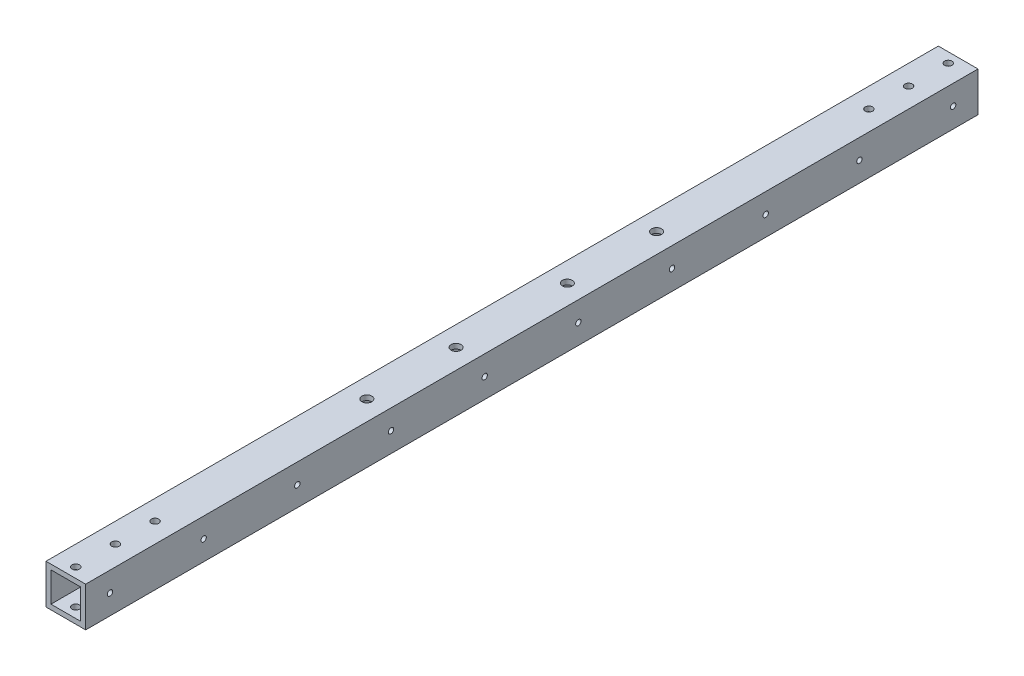
from build123d import *

# Parameters (mm, degrees)
SKETCH1_W                      = 25.4
SKETCH1_H                      = 25.4
SKETCH1_W_2                    = 19.05
SKETCH1_H_2                    = 19.05
EXTRUDE_THIN1_DEPTH            = 571.5
F_3_16_0_1875_DIAMETER_HOLE1_D = 4.7625
F_1_4_0_25_DIAMETER_HOLE1_D    = 6.35
F_8_32_TAPPED_HOLE1_D          = 3.4544
F_8_32_TAPPED_HOLE1_DEPTH      = 12.2936
F_8_32_TAPPED_HOLE1_TIP        = 1.037806461


with BuildPart() as part:
    # Sketch1 → Extrude-Thin1 (new body)
    with BuildSketch(Plane.XY):
        Rectangle(SKETCH1_W, SKETCH1_H)
        Rectangle(SKETCH1_W_2, SKETCH1_H_2, mode=Mode.SUBTRACT)
    extrude(amount=EXTRUDE_THIN1_DEPTH)

    # 3/16 (0.1875) Diameter Hole1 (through all)
    with Locations(Plane(origin=(0, 12.7, 565.15), x_dir=(0, 0, 1), z_dir=(0, 1, 0))):
        with Locations((0, 0), (-558.8, 0), (-533.4, 0), (-508, 0), (-25.4, 0), (-50.8, 0)):
            Hole(F_3_16_0_1875_DIAMETER_HOLE1_D / 2)

    # 1/4 (0.25) Diameter Hole1 (through all)
    with Locations(Plane(origin=(0, 12.7, 0), x_dir=(1, 0, 0), z_dir=(0, 1, 0))):
        with Locations((0, -321.564), (0, -378.714), (0, -193.167), (0, -250.317)):
            Hole(F_1_4_0_25_DIAMETER_HOLE1_D / 2)

    # #8-32 Tapped Hole1
    with Locations(Plane(origin=(12.7, -82.55, 285.75), x_dir=(0, 0, -1), z_dir=(1, 0, 0))):
        with Locations((-270.1905, 82.55), (-210.1905, 82.55), (-150.1905, 82.55), (-90.1905, 82.55), (-30.1905, 82.55), (29.8095, 82.55), (89.8095, 82.55), (149.8095, 82.55), (209.8095, 82.55), (269.8095, 82.55)):
            Hole(F_8_32_TAPPED_HOLE1_D / 2, depth=F_8_32_TAPPED_HOLE1_DEPTH)
            with Locations((0, 0, -(F_8_32_TAPPED_HOLE1_DEPTH + F_8_32_TAPPED_HOLE1_TIP / 2))):  # 118° drill point
                Cone(0, F_8_32_TAPPED_HOLE1_D / 2, F_8_32_TAPPED_HOLE1_TIP, mode=Mode.SUBTRACT)


solid = part.part
